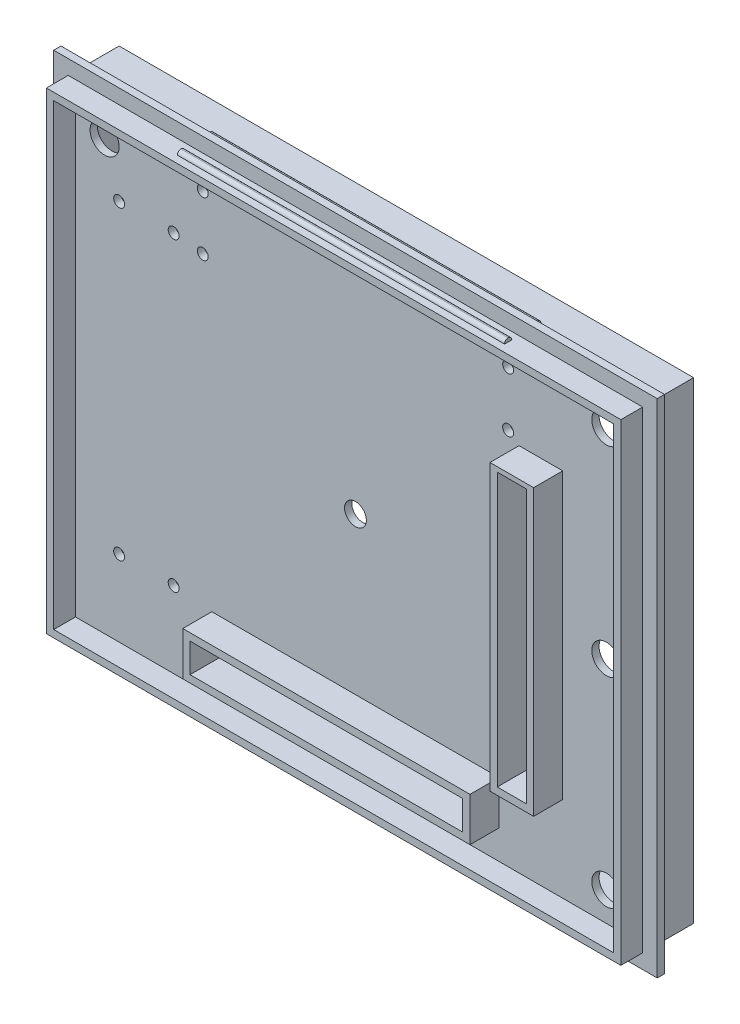
from build123d import *

# Parameters (mm, degrees)
SKETCH_1_W                     = 166
SKETCH_1_H                     = 138
EXTRUDE_1_DEPTH                = 2
EXTRUDE_2_DEPTH                = 6
EXTRUDE_2_DEPTH_BACK           = 14
SKETCH_2_W                     = 158
SKETCH_2_H                     = 130
SKETCH_2_W_2                   = 154
SKETCH_2_H_2                   = 126
SKETCH_3_R                     = 1.5
EXTRUDE_2_2_DEPTH              = 5
SKETCH_5_R                     = 1.5
EXTRUDE_3_DEPTH                = 5
SKETCH_4_R                     = 1.5
EXTRUDE_4_DEPTH                = 5
SKETCH_6_W                     = 75
SKETCH_6_H                     = 2
SKETCH_6_W_2                   = 2
SKETCH_6_H_2                   = 75
EXTRUDE_5_DEPTH                = 8
SKETCH_9_W                     = 90
SKETCH_9_H                     = 2
EXTRUDE_6_DEPTH                = 1
FILLET_1_R                     = 1
SKETCH_11_W                    = 90
SKETCH_11_H                    = 2
EXTRUDE_7_DEPTH                = 1
FILLET_2_R                     = 1
PATTERN_LINEAR_1_COUNT         = 2
PATTERN_LINEAR_1_PITCH         = 8
FILLET_1_OF_PATTERN_LINEAR_1_R = 1
PATTERN_LINEAR_2_COUNT         = 2
PATTERN_LINEAR_2_PITCH         = 8
FILLET_2_OF_PATTERN_LINEAR_2_R = 1
SKETCH_12_W                    = 2
SKETCH_12_H                    = 12
SKETCH_12_W_2                  = 12
SKETCH_12_H_2                  = 2
SKETCH_12_H_3                  = 1.3
EXTRUDE_8_DEPTH                = 8
CUT_EXTRUDE_2_DEPTH            = 109.839331126
CUT_EXTRUDE_2_DEPTH_BACK       = 109.839331126
SKETCH_5_4_R                   = 1.5
CUT_EXTRUDE_3_DEPTH            = 109.839331126
CUT_EXTRUDE_3_DEPTH_BACK       = 109.839331126
SKETCH_4_3_R                   = 1.5
CUT_EXTRUDE_4_DEPTH            = 109.839331126
CUT_EXTRUDE_4_DEPTH_BACK       = 109.839331126
SKETCH_3_2_R                   = 1.5
SKETCH_13_R                    = 3
SKETCH_13_R_2                  = 4
CUT_EXTRUDE_5_DEPTH            = 109.839331126


with BuildPart() as part:
    # 스케치1 → 보스-돌출1 (new body)
    with BuildSketch(Plane.XY):
        Rectangle(SKETCH_1_W, SKETCH_1_H)
    extrude(amount=EXTRUDE_1_DEPTH)

    # 스케치2 → Extrude 2 (add, two sides: drawn at the far end of the back side and taken through both)
    with BuildSketch(Plane.XY.offset(2).offset(-EXTRUDE_2_DEPTH_BACK)):
        Rectangle(SKETCH_2_W, SKETCH_2_H)
        Rectangle(SKETCH_2_W_2, SKETCH_2_H_2, mode=Mode.SUBTRACT)
    extrude(amount=EXTRUDE_2_DEPTH + EXTRUDE_2_DEPTH_BACK)

    # 스케치3 → Extrude 2 2 (add)
    with BuildSketch(Plane.XY.offset(2)):
        with Locations(Location((-65, -42, 0), (0, 0, 180))):
            Circle(SKETCH_3_R)
        with Locations(Location((-50, -42, 0), (0, 0, 180))):
            Circle(SKETCH_3_R)
        with Locations(Location((-65, 42, 0), (0, 0, 180))):
            Circle(SKETCH_3_R)
        with Locations(Location((-50, 42, 0), (0, 0, 180))):
            Circle(SKETCH_3_R)
    extrude(amount=EXTRUDE_2_2_DEPTH)

    # 스케치5 → 보스-돌출3 (add)
    with BuildSketch(Plane.XY.offset(2)):
        with Locations(Location((42, 56, 0), (0, 0, 180))):
            Circle(SKETCH_5_R)
        with Locations(Location((42, 41, 0), (0, 0, 180))):
            Circle(SKETCH_5_R)
    extrude(amount=EXTRUDE_3_DEPTH)

    # 스케치4 → 보스-돌출4 (add)
    with BuildSketch(Plane.XY.offset(2)):
        with Locations(Location((-42, 56, 0), (0, 0, 180))):
            Circle(SKETCH_4_R)
        with Locations(Location((-42, 41, 0), (0, 0, 180))):
            Circle(SKETCH_4_R)
    extrude(amount=EXTRUDE_4_DEPTH)

    # 스케치6 → 보스-돌출5 (add)
    with BuildSketch(Plane.XY.offset(2)):
        with Locations((0, -54)):
            Rectangle(SKETCH_6_W, SKETCH_6_H)
        with Locations((0, -44)):
            Rectangle(SKETCH_6_W, SKETCH_6_H)
        with Locations((46, 0)):
            Rectangle(SKETCH_6_W_2, SKETCH_6_H_2)
        with Locations((56, 0)):
            Rectangle(SKETCH_6_W_2, SKETCH_6_H_2)
    extrude(amount=EXTRUDE_5_DEPTH)

    # 스케치9 → 보스-돌출6 (add)
    with BuildSketch(Plane.XZ.offset(65)):
        with Locations((0, 5)):
            Rectangle(SKETCH_9_W, SKETCH_9_H)
    extrude_6 = extrude(amount=EXTRUDE_6_DEPTH)

    # 필렛1
    fillet_1_edges = [part.edges().sort_by_distance(p)[0] for p in [
        (0, -66, 4),
        (0, -66, 6),
    ]]
    fillet(fillet_1_edges, radius=FILLET_1_R - 0.0001)  # a hair under: the kernel refuses the full size

    # 스케치11 → 보스-돌출7 (add)
    with BuildSketch(Plane(origin=(0, 65, 0), x_dir=(1, 0, 0), z_dir=(0, 1, 0))):
        with Locations((0, -5)):
            Rectangle(SKETCH_11_W, SKETCH_11_H)
    extrude_7 = extrude(amount=EXTRUDE_7_DEPTH)

    # 필렛2
    fillet_2_edges = [part.edges().sort_by_distance(p)[0] for p in [
        (0, 66, 4),
        (0, 66, 6),
    ]]
    fillet(fillet_2_edges, radius=FILLET_2_R - 0.0001)  # a hair under: the kernel refuses the full size

    # 선형 패턴1: 보스-돌출6 ×2
    with Locations(*[(0, 0, -i * PATTERN_LINEAR_1_PITCH) for i in range(1, PATTERN_LINEAR_1_COUNT)]):
        add(extrude_6)

    # 필렛1 of 선형 패턴1
    fillet_1_of_pattern_linear_1_edges = [part.edges().sort_by_distance(p)[0] for p in [
        (0, -66, -4),
        (0, -66, -2),
    ]]
    fillet(fillet_1_of_pattern_linear_1_edges, radius=FILLET_1_OF_PATTERN_LINEAR_1_R - 0.0001)  # a hair under: the kernel refuses the full size

    # 선형 패턴2: 보스-돌출7 ×2
    with Locations(*[(0, 0, -i * PATTERN_LINEAR_2_PITCH) for i in range(1, PATTERN_LINEAR_2_COUNT)]):
        add(extrude_7)

    # 필렛2 of 선형 패턴2
    fillet_2_of_pattern_linear_2_edges = [part.edges().sort_by_distance(p)[0] for p in [
        (0, 66, -4),
        (0, 66, -2),
    ]]
    fillet(fillet_2_of_pattern_linear_2_edges, radius=FILLET_2_OF_PATTERN_LINEAR_2_R - 0.0001)  # a hair under: the kernel refuses the full size

    # 스케치12 → 보스-돌출8 (add)
    with BuildSketch(Plane.XY.offset(2)):
        with Locations((-38.5, -49)):
            Rectangle(SKETCH_12_W, SKETCH_12_H)
        with Locations((38.5, -49)):
            Rectangle(SKETCH_12_W, SKETCH_12_H)
        with Locations((51, -38.5)):
            Rectangle(SKETCH_12_W_2, SKETCH_12_H_2)
        with Locations((51, 38.15)):
            Rectangle(SKETCH_12_W_2, SKETCH_12_H_3)
    extrude(amount=EXTRUDE_8_DEPTH)

    # 스케치5<4> → 컷-돌출2 (cut, two sides: drawn at the far end of the back side and taken through both)
    with BuildSketch(Plane.XY.offset(2).offset(-CUT_EXTRUDE_2_DEPTH_BACK)):
        with Locations(Location((42, 56, 0), (0, 0, 180))):
            Circle(SKETCH_5_4_R)
        with Locations(Location((42, 41, 0), (0, 0, 180))):
            Circle(SKETCH_5_4_R)
    extrude(amount=CUT_EXTRUDE_2_DEPTH + CUT_EXTRUDE_2_DEPTH_BACK, mode=Mode.SUBTRACT)

    # 스케치4<3> → 컷-돌출3 (cut, two sides: drawn at the far end of the back side and taken through both)
    with BuildSketch(Plane.XY.offset(2).offset(-CUT_EXTRUDE_3_DEPTH_BACK)):
        with Locations(Location((-42, 56, 0), (0, 0, 180))):
            Circle(SKETCH_4_3_R)
        with Locations(Location((-42, 41, 0), (0, 0, 180))):
            Circle(SKETCH_4_3_R)
    extrude(amount=CUT_EXTRUDE_3_DEPTH + CUT_EXTRUDE_3_DEPTH_BACK, mode=Mode.SUBTRACT)

    # 스케치3<2> → 컷-돌출4 (cut, two sides: drawn at the far end of the back side and taken through both)
    with BuildSketch(Plane.XY.offset(2).offset(-CUT_EXTRUDE_4_DEPTH_BACK)):
        with Locations(Location((-65, -42, 0), (0, 0, 180))):
            Circle(SKETCH_3_2_R)
        with Locations(Location((-50, -42, 0), (0, 0, 180))):
            Circle(SKETCH_3_2_R)
        with Locations(Location((-65, 42, 0), (0, 0, 180))):
            Circle(SKETCH_3_2_R)
        with Locations(Location((-50, 42, 0), (0, 0, 180))):
            Circle(SKETCH_3_2_R)
    extrude(amount=CUT_EXTRUDE_4_DEPTH + CUT_EXTRUDE_4_DEPTH_BACK, mode=Mode.SUBTRACT)

    # 스케치13 → 컷-돌출5 (cut, through all)
    with BuildSketch(Plane.XY.offset(2)):
        Circle(SKETCH_13_R)
        with Locations((-69, 55)):
            Circle(SKETCH_13_R_2)
        with Locations(Location((69, 55, 0), (0, 0, 180))):
            Circle(SKETCH_13_R_2)
        with Locations((69, -55)):
            Circle(SKETCH_13_R_2)
        with Locations((69, 0)):
            Circle(SKETCH_13_R_2)
    extrude(amount=-CUT_EXTRUDE_5_DEPTH, mode=Mode.SUBTRACT)


solid = part.part
